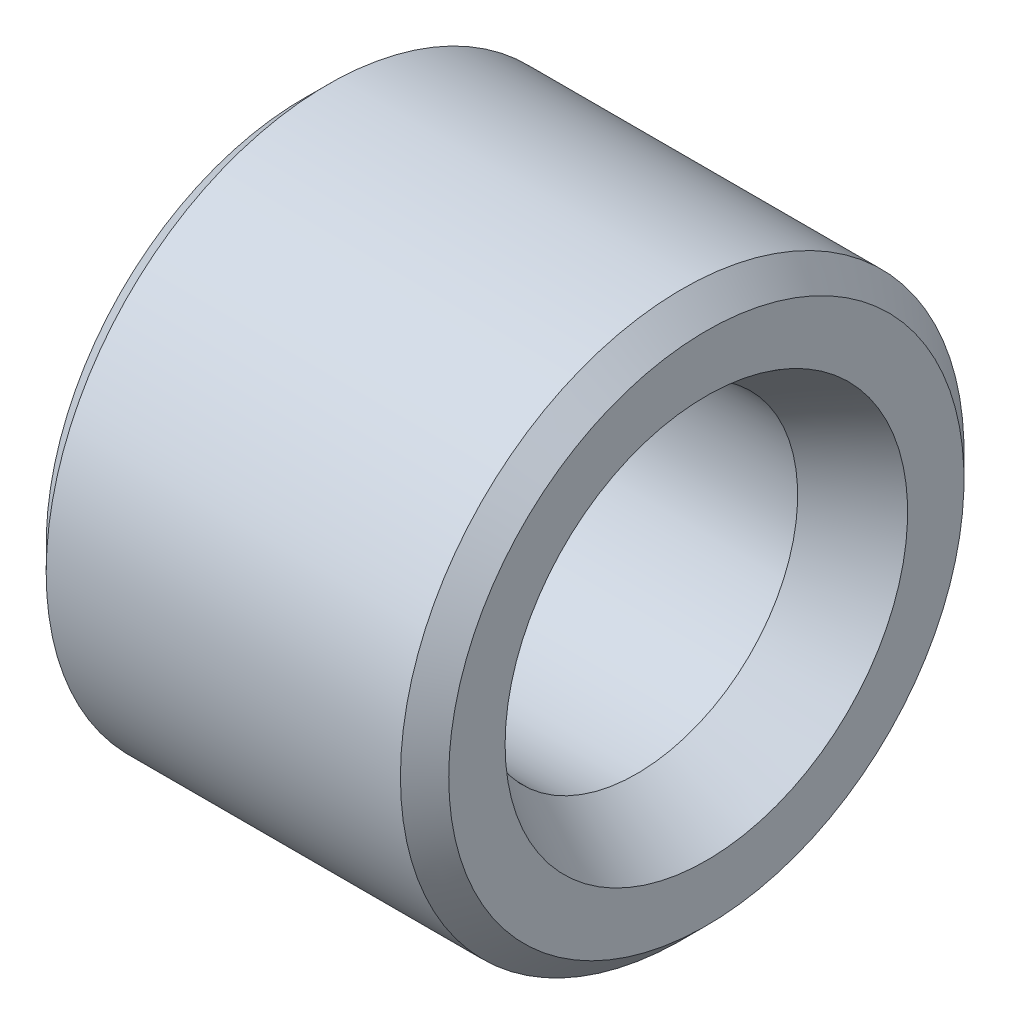
from build123d import *

# Parameters (mm, degrees)
SKETCH1_W     = 5
SKETCH1_H     = 1.5
CHAMFER1_SIZE = 0.3


with BuildPart() as part:
    # Sketch1 → Revolve1 (revolve)
    with BuildSketch(Plane.XY):
        with Locations((2.5, 2.75)):
            Rectangle(SKETCH1_W, SKETCH1_H)
    revolve(axis=Axis((0, 0, 0), (1, 0, 0)))

    # Chamfer1
    chamfer1_edges = [part.edges().sort_by_distance(p)[0] for p in [
        (5, -3.5, 0),
        (0, -3.5, 0),
    ]]
    chamfer(chamfer1_edges, length=CHAMFER1_SIZE)

    # Sketch2 → Cut-Revolve1 (revolve, cut)
    with BuildSketch(Plane.XY):
        Polygon((0, 2.5), (0, 2), (0.866025404, 2), align=None)
        Polygon((4.133974596, 2), (5, 2.5), (5, 2), align=None)
    revolve(axis=Axis((0, 0, 0), (1, 0, 0)), mode=Mode.SUBTRACT)


solid = part.part
